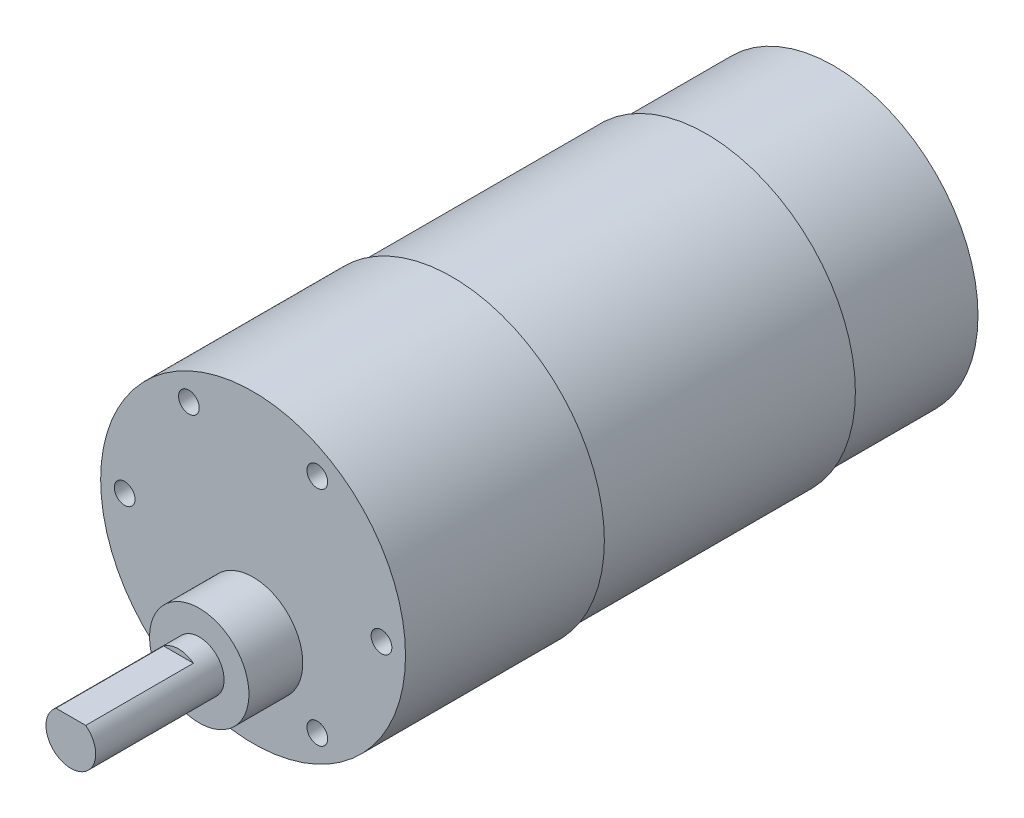
from build123d import *

# Parameters (mm, degrees)
SKETCH1_R                       = 17.4
BOSS_EXTRUDE1_DEPTH             = 15.4
SKETCH2_R                       = 18
BOSS_EXTRUDE2_DEPTH             = 30.7
SKETCH3_R                       = 18.4
BOSS_EXTRUDE3_DEPTH             = 24
SKETCH4_R                       = 6
BOSS_EXTRUDE4_DEPTH             = 6.5
SKETCH5_R                       = 3
BOSS_EXTRUDE5_DEPTH             = 15.5
CUT_EXTRUDE1_START              = -13
CUT_EXTRUDE1_DEPTH              = 13
TAP_DRILL_FOR_M3X0_5_TAP1_D     = 2.5
TAP_DRILL_FOR_M3X0_5_TAP1_DEPTH = 10.76


with BuildPart() as part:
    # Sketch1 → Boss-Extrude1 (new body)
    with BuildSketch(Plane.XY):
        Circle(SKETCH1_R)
    extrude(amount=BOSS_EXTRUDE1_DEPTH)

    # Sketch2 → Boss-Extrude2 (add)
    with BuildSketch(Plane.XY.offset(15.4)):
        Circle(SKETCH2_R)
    extrude(amount=BOSS_EXTRUDE2_DEPTH)

    # Sketch3 → Boss-Extrude3 (add)
    with BuildSketch(Plane.XY.offset(46.1)):
        Circle(SKETCH3_R)
    extrude(amount=BOSS_EXTRUDE3_DEPTH)

    # Sketch4 → Boss-Extrude4 (add)
    with BuildSketch(Plane.XY.offset(70.1)):
        with Locations((0, -7)):
            Circle(SKETCH4_R)
    extrude(amount=BOSS_EXTRUDE4_DEPTH)

    # Sketch5 → Boss-Extrude5 (add)
    with BuildSketch(Plane.XY.offset(76.6)):
        with Locations((0, -7)):
            Circle(SKETCH5_R)
    extrude(amount=BOSS_EXTRUDE5_DEPTH)

    # Sketch6 → Cut-Extrude1 (cut)
    with BuildSketch(Plane.XY.offset(92.1).offset(CUT_EXTRUDE1_START)):
        with BuildLine():
            Line((-1.8, -4.6), (1.8, -4.6))
            ThreePointArc((1.8, -4.6), (0, -4), (-1.8, -4.6))
        make_face()
    extrude(amount=CUT_EXTRUDE1_DEPTH, mode=Mode.SUBTRACT)

    # Tap Drill for M3x0.5 Tap1
    with Locations(Plane.XY.offset(70.1)):
        with Locations((-15.5, 0), (-7.75, 13.423393759), (7.75, 13.423393759), (15.5, 0), (7.75, -13.423393759), (-7.75, -13.423393759)):
            Hole(TAP_DRILL_FOR_M3X0_5_TAP1_D / 2, depth=TAP_DRILL_FOR_M3X0_5_TAP1_DEPTH)


solid = part.part
